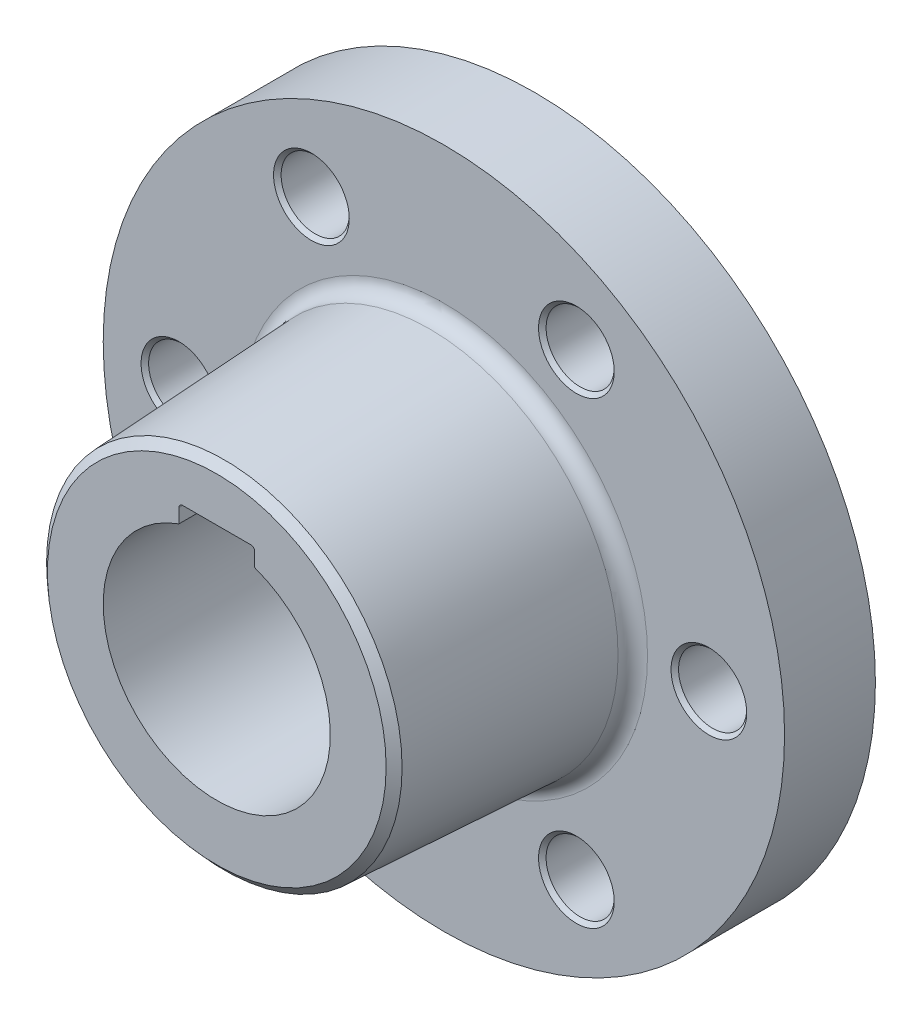
from build123d import *

# Parameters (mm, degrees)
SKICA1_R                      = 45
P_IDAT_VYSUNUT_M1_DEPTH       = 12
SKICA2_R                      = 25
P_IDAT_VYSUNUT_M2_DEPTH       = 30
P_IDAT_VYSUNUT_M2_TAPER       = 3
ODEBRAT_VYSUNUT_M1_REACH      = 78.25
SKICA3_R                      = 15
ODEBRAT_VYSUNUT_M2_REACH      = 78.25
SKICA4_W                      = 10
SKICA4_H                      = 3.370987204
ZAOBLIT1_R                    = 2
ODEBRAT_VYSUNUT_M3_REACH      = 72.356
SKICA5_R                      = 4.5
ZKOSEN_1_SIZE                 = 0.5
KRUHOV_POLE1_COUNT            = 6
ZKOSEN_1_OF_KRUHOV_POLE1_SIZE = 0.5
ZAOBLIT2_R                    = 0.5
ZKOSEN_2_SIZE                 = 1.056754503
ZKOSEN_2_SIZE_2               = 1


with BuildPart() as part:
    # Skica1 → Přidat vysunutím1 (new body)
    with BuildSketch(Plane.XY):
        Circle(SKICA1_R)
    extrude(amount=P_IDAT_VYSUNUT_M1_DEPTH)

    # Skica2 → Přidat vysunutím2 (add)
    with BuildSketch(Plane.XY.offset(12)):
        Circle(SKICA2_R)
    extrude(amount=P_IDAT_VYSUNUT_M2_DEPTH, taper=P_IDAT_VYSUNUT_M2_TAPER)

    # Skica3 → Odebrat vysunutím1 (cut, up to next)
    with BuildSketch(Plane.XY.offset(42), mode=Mode.PRIVATE) as odebrat_vysunut_m1_sk1:
        Circle(SKICA3_R)
    odebrat_vysunut_m1_tool1 = extrude(odebrat_vysunut_m1_sk1.sketch, amount=-ODEBRAT_VYSUNUT_M1_REACH, mode=Mode.PRIVATE) & part.part
    add(odebrat_vysunut_m1_tool1.solids().sort_by_distance((0, 0, 42))[0], mode=Mode.SUBTRACT)

    # Skica4 → Odebrat vysunutím2 (cut, up to next)
    with BuildSketch(Plane.XY.offset(42), mode=Mode.PRIVATE) as odebrat_vysunut_m2_sk1:
        with Locations((0, 14.814506398)):
            Rectangle(SKICA4_W, SKICA4_H)
    odebrat_vysunut_m2_tool1 = extrude(odebrat_vysunut_m2_sk1.sketch, amount=-ODEBRAT_VYSUNUT_M2_REACH, mode=Mode.PRIVATE) & part.part
    add(odebrat_vysunut_m2_tool1.solids().sort_by_distance((0, 14.814506, 42))[0], mode=Mode.SUBTRACT)

    # Zaoblit1
    zaoblit1_edges = [part.edges().sort_by_distance(p)[0] for p in [
        (-25, 0, 12),
    ]]
    fillet(zaoblit1_edges, radius=ZAOBLIT1_R)

    # Skica5 → Odebrat vysunutím3 (cut, up to next)
    with BuildSketch(Plane.XY.offset(12), mode=Mode.PRIVATE) as odebrat_vysunut_m3_sk1:
        with Locations((35, 0)):
            Circle(SKICA5_R)
    odebrat_vysunut_m3_tool1 = extrude(odebrat_vysunut_m3_sk1.sketch, amount=-ODEBRAT_VYSUNUT_M3_REACH, mode=Mode.PRIVATE) & part.part
    odebrat_vysunut_m3 = odebrat_vysunut_m3_tool1.solids().sort_by_distance((35, 0, 12))[0]
    add(odebrat_vysunut_m3, mode=Mode.SUBTRACT)

    # Zkosení1
    zkosen_1_edges = [part.edges().sort_by_distance(p)[0] for p in [
        (30.5, 0, 12),
    ]]
    chamfer(zkosen_1_edges, length=ZKOSEN_1_SIZE)

    # Kruhové pole1: Odebrat vysunutím3 ×6 about axis
    kruhov_pole1_axis = Axis((0, 0, 0), (0, 0, 1))
    for i in range(1, KRUHOV_POLE1_COUNT):
        add(odebrat_vysunut_m3.rotate(kruhov_pole1_axis, i * 360 / KRUHOV_POLE1_COUNT), mode=Mode.SUBTRACT)

    # Zkosení1 of Kruhové pole1
    zkosen_1_of_kruhov_pole1_edges = [part.edges().sort_by_distance(p)[0] for p in [
        (15.25, 26.413774815, 12),
        (-15.25, 26.413774815, 12),
        (-30.5, 0, 12),
        (-15.25, -26.413774815, 12),
        (15.25, -26.413774815, 12),
    ]]
    chamfer(zkosen_1_of_kruhov_pole1_edges, length=ZKOSEN_1_OF_KRUHOV_POLE1_SIZE)

    # Zaoblit2
    zaoblit2_edges = [part.edges().sort_by_distance(p)[0] for p in [
        (-5, 16.5, 21),
        (5, 16.5, 21),
    ]]
    fillet(zaoblit2_edges, radius=ZAOBLIT2_R)

    # Zkosení2
    # the kernel refuses this chamfer: 1.056754503, 1 mm, written as the material it takes off along each edge
    with BuildSketch(Plane(origin=(0, 0, 42), x_dir=(1, 0, 0), z_dir=(0, 1, 0))) as zkosen_2_piece_1:
        Polygon((23.427766622 - ZKOSEN_2_SIZE, 0), (23.427766622 + ZKOSEN_2_SIZE_2 * 0.0523359562429, ZKOSEN_2_SIZE_2 * 0.998629534755), (23.427766622, 0), align=None)
    revolve(axis=Axis((0, 0, 42), (0, 0, -1)), mode=Mode.SUBTRACT)


solid = part.part
